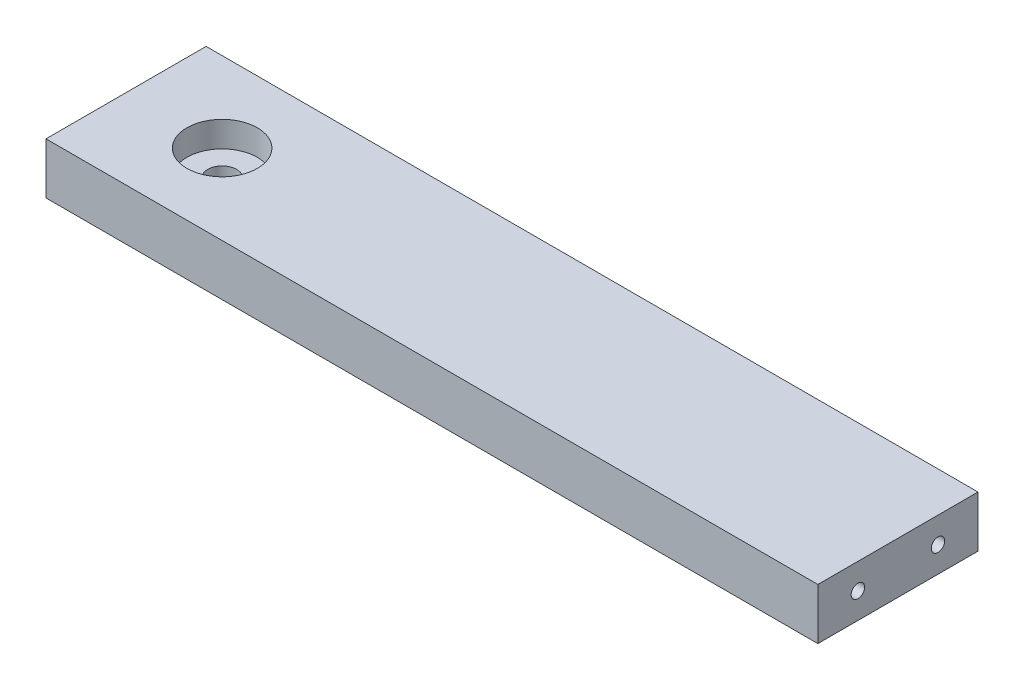
from build123d import *

# Parameters (mm, degrees)
SKETCH2_W             = 241
SKETCH2_H             = 50
BOSS_EXTRUDE1_DEPTH   = 16
SKETCH3_R             = 11
CUT_EXTRUDE1_DEPTH    = 8
SKETCH6_R             = 4.5
CUT_EXTRUDE2_DEPTH    = 124.325788057
M5_TAPPED_HOLE4_D     = 4.2
M5_TAPPED_HOLE4_DEPTH = 22.4
M5_TAPPED_HOLE4_TIP   = 1.2618073


with BuildPart() as part:
    # Sketch2 → Boss-Extrude1 (new body)
    with BuildSketch(Plane(origin=(0, 0, 0), x_dir=(1, 0, 0), z_dir=(0, 1, 0))):
        Rectangle(SKETCH2_W, SKETCH2_H)
    extrude(amount=BOSS_EXTRUDE1_DEPTH)

    # Sketch3 → Cut-Extrude1 (cut)
    with BuildSketch(Plane(origin=(0, 16, 0), x_dir=(1, 0, 0), z_dir=(0, 1, 0))):
        with Locations((-90.5, 0)):
            Circle(SKETCH3_R)
    extrude(amount=-CUT_EXTRUDE1_DEPTH, mode=Mode.SUBTRACT)

    # Sketch6 → Cut-Extrude2 (cut, through all)
    with BuildSketch(Plane(origin=(0, 8, 0), x_dir=(1, 0, 0), z_dir=(0, 1, 0))):
        with Locations((-90.5, 0)):
            Circle(SKETCH6_R)
    extrude(amount=-CUT_EXTRUDE2_DEPTH, mode=Mode.SUBTRACT)

    # M5 Tapped Hole4
    with Locations(Plane(origin=(120.5, 0, 0), x_dir=(0, 0, -1), z_dir=(1, 0, 0))):
        with Locations((-12.5, 8), (12.5, 8)):
            Hole(M5_TAPPED_HOLE4_D / 2, depth=M5_TAPPED_HOLE4_DEPTH)
            with Locations((0, 0, -(M5_TAPPED_HOLE4_DEPTH + M5_TAPPED_HOLE4_TIP / 2))):  # 118° drill point
                Cone(0, M5_TAPPED_HOLE4_D / 2, M5_TAPPED_HOLE4_TIP, mode=Mode.SUBTRACT)


solid = part.part
